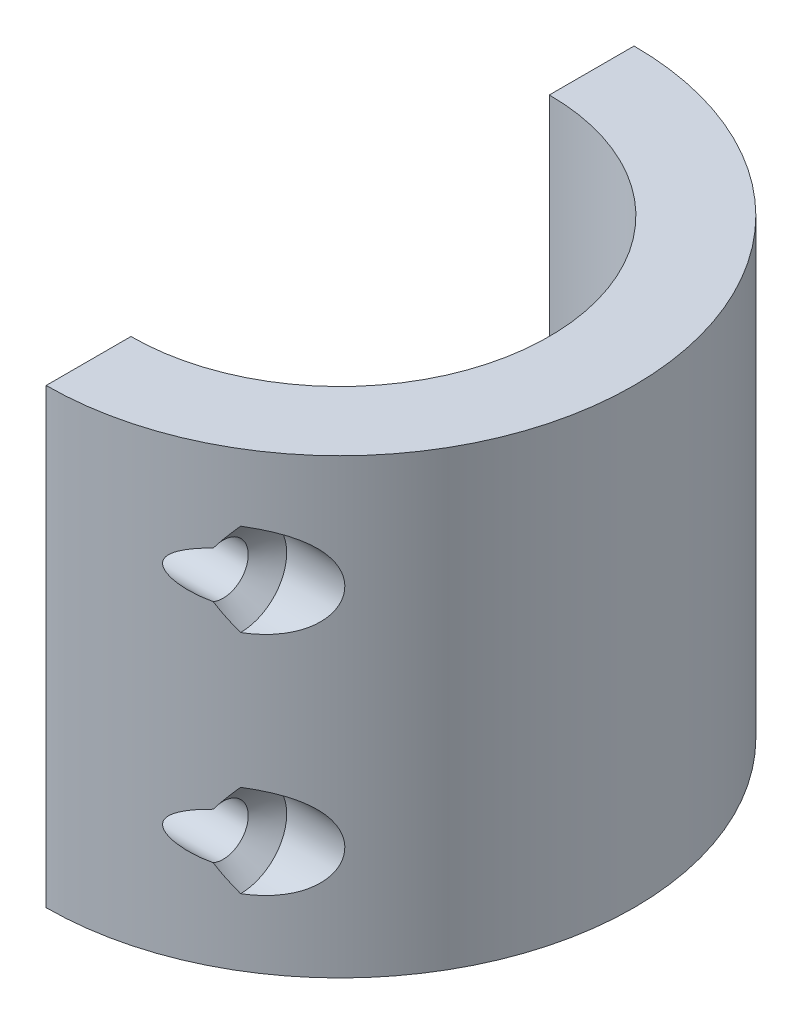
from build123d import *

# Parameters (mm, degrees)
BOSS_EXTRUDE1_DEPTH = 20.32


# Read off the part's stored shape, not the designer's step: #2 Clearance Hole1
with BuildPart() as part:
    # Sketch1 → Boss-Extrude1 (new body)
    with BuildSketch(Plane(origin=(0, 0, 0), x_dir=(1, 0, 0), z_dir=(0, 1, 0))):
        with BuildLine():
            Line((0, 13.208), (0, 9.398))
            ThreePointArc((0, 9.398), (9.398, 0), (0, -9.398))
            Line((0, -9.398), (0, -13.208))
            ThreePointArc((0, -13.208), (13.208, 0), (0, 13.208))
        make_face()
    extrude(amount=BOSS_EXTRUDE1_DEPTH)

    # #2 Clearance Hole1 outline → #2 Clearance Hole1 (revolve, cut)
    with BuildSketch(Plane(origin=(0, 5.08, -11.303), x_dir=(0, 1, 0), z_dir=(0, 0, -1))):
        Polygon((2.0701, 6.833260935), (2.0701, 9.445172288), (0, 9.445172288), (0, 0), (1.1303, 0), (1.1303, 6.044675101), align=None)
    revolve(axis=Axis((0, 5.08, -11.303), (1, 0, 0)), mode=Mode.SUBTRACT)

    # 2 Clearance Hole1 2 outline → 2 Clearance Hole1 2 (revolve, cut)
    with BuildSketch(Plane(origin=(0, 5.08, 11.303), x_dir=(0, 1, 0), z_dir=(0, 0, -1))):
        Polygon((2.0701, 9.445172288), (0, 9.445172288), (0, 0), (1.1303, 0), (1.1303, 6.044675101), (2.0701, 6.833260935), align=None)
    revolve(axis=Axis((0, 5.08, 11.303), (1, 0, 0)), mode=Mode.SUBTRACT)

    # 2 Clearance Hole1 3 outline → 2 Clearance Hole1 3 (revolve, cut)
    with BuildSketch(Plane(origin=(0, 15.24, 11.303), x_dir=(0, 1, 0), z_dir=(0, 0, -1))):
        Polygon((2.0701, 9.445172288), (0, 9.445172288), (0, 0), (1.1303, 0), (1.1303, 6.044675101), (2.0701, 6.833260935), align=None)
    revolve(axis=Axis((0, 15.24, 11.303), (1, 0, 0)), mode=Mode.SUBTRACT)

    # 2 Clearance Hole1 4 outline → 2 Clearance Hole1 4 (revolve, cut)
    with BuildSketch(Plane(origin=(0, 15.24, -11.303), x_dir=(0, 1, 0), z_dir=(0, 0, -1))):
        Polygon((2.0701, 9.445172288), (0, 9.445172288), (0, 0), (1.1303, 0), (1.1303, 6.044675101), (2.0701, 6.833260935), align=None)
    revolve(axis=Axis((0, 15.24, -11.303), (1, 0, 0)), mode=Mode.SUBTRACT)


solid = part.part
